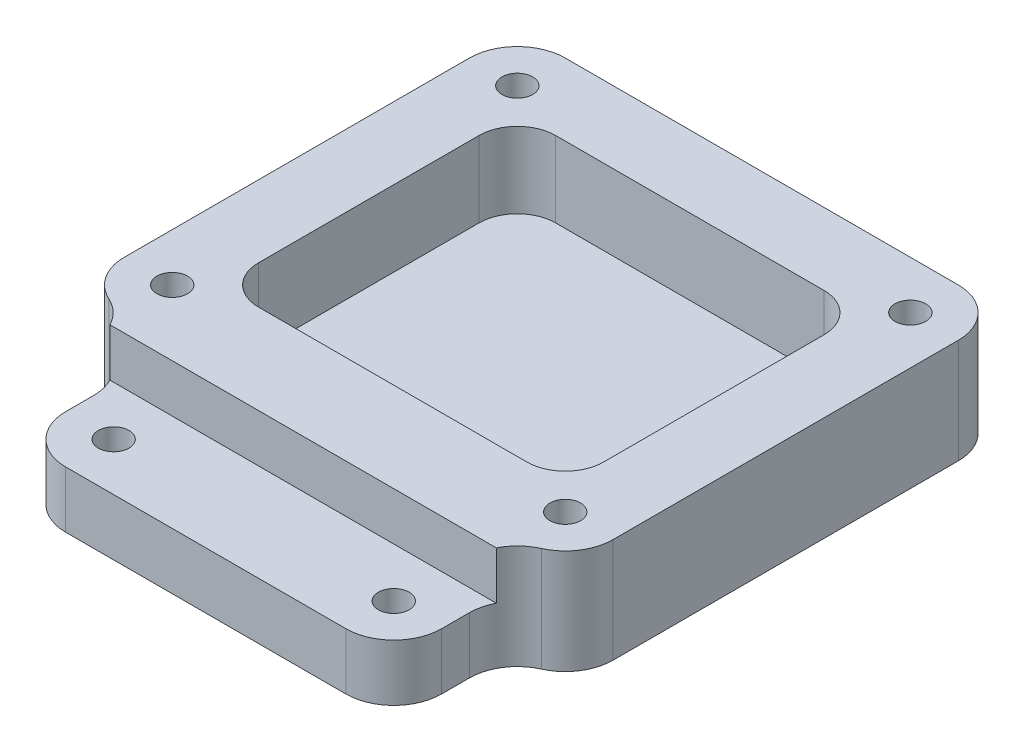
from build123d import *

# Parameters (mm, degrees)
SKETCH_1_W          = 51
SKETCH_1_H          = 46
SKETCH_1_R          = 1.6
SKETCH_1_W_2        = 39.22
SKETCH_1_H_2        = 12
EXTRUDE_1_DEPTH     = 10.9
SKETCH_2_W          = 39.22
SKETCH_2_H          = 10.3
CUT_EXTRUDE_1_DEPTH = 5
FILLET_1_R          = 5
SKETCH_3_W          = 36
SKETCH_3_H          = 31
CUT_EXTRUDE_2_DEPTH = 7.9
FILLET_3_R          = 4
FILLET_2_R          = 5


with BuildPart() as part:
    # ｽｹｯﾁ1 → ﾎﾞｽ - 押し出し1 (new body)
    # profile 1 of 2: a face of its own
    with BuildSketch(Plane(origin=(0, 0, 0), x_dir=(1, 0, 0), z_dir=(0, 1, 0))):
        Rectangle(SKETCH_1_W, SKETCH_1_H)
        with Locations(Location((-20.5, 18, 0), (0, 0, 270))):
            Circle(SKETCH_1_R, mode=Mode.SUBTRACT)
        with Locations(Location((20.5, 18, 0), (0, 0, 270))):
            Circle(SKETCH_1_R, mode=Mode.SUBTRACT)
        with Locations(Location((-20.5, -18, 0), (0, 0, 270))):
            Circle(SKETCH_1_R, mode=Mode.SUBTRACT)
        with Locations(Location((20.5, -18, 0), (0, 0, 270))):
            Circle(SKETCH_1_R, mode=Mode.SUBTRACT)
    # profile 2 of 2: a face of its own
    with BuildSketch(Plane(origin=(0, 0, 0), x_dir=(1, 0, 0), z_dir=(0, 1, 0))):
        with Locations((0, -29)):
            Rectangle(SKETCH_1_W_2, SKETCH_1_H_2)
        with Locations(Location((-14.61, -30, 0), (0, 0, 270))):
            Circle(SKETCH_1_R, mode=Mode.SUBTRACT)
        with Locations(Location((14.61, -30, 0), (0, 0, 270))):
            Circle(SKETCH_1_R, mode=Mode.SUBTRACT)
    extrude(amount=EXTRUDE_1_DEPTH)

    # ｽｹｯﾁ2 → ｶｯﾄ - 押し出し1 (cut)
    with BuildSketch(Plane(origin=(0, 10.9, 0), x_dir=(1, 0, 0), z_dir=(0, 1, 0))):
        with Locations((0, -30)):
            Rectangle(SKETCH_2_W, SKETCH_2_H)
    extrude(amount=-CUT_EXTRUDE_1_DEPTH, mode=Mode.SUBTRACT)

    # ﾌｨﾚｯﾄ1
    fillet_1_edges = [part.edges().sort_by_distance(p)[0] for p in [
        (-25.5, 5.45, 23),
        (-25.5, 5.45, -23),
        (25.5, 5.45, -23),
        (25.5, 5.45, 23),
        (19.61, 2.95, 35),
        (-19.61, 2.95, 35),
    ]]
    fillet(fillet_1_edges, radius=FILLET_1_R)

    # ｽｹｯﾁ3 → ｶｯﾄ - 押し出し2 (cut)
    with BuildSketch(Plane(origin=(0, 10.9, 0), x_dir=(1, 0, 0), z_dir=(0, 1, 0))):
        Rectangle(SKETCH_3_W, SKETCH_3_H)
    extrude(amount=-CUT_EXTRUDE_2_DEPTH, mode=Mode.SUBTRACT)

    # ﾌｨﾚｯﾄ3
    fillet_3_edges = [part.edges().sort_by_distance(p)[0] for p in [
        (18, 6.95, -15.5),
        (18, 6.95, 15.5),
        (-18, 6.95, 15.5),
        (-18, 6.95, -15.5),
    ]]
    fillet(fillet_3_edges, radius=FILLET_3_R)

    # ﾌｨﾚｯﾄ2
    # the kernel refuses this fillet: 5 mm, written as the material it adds along each edge
    with BuildSketch(Plane(origin=(-19.61, 0, 23), x_dir=(-0.9889327426199618, 0, -0.14836451925632577), z_dir=(0, 1, 0))) as fillet_2_piece_1_section:
        with BuildLine():
            CenterArc((4.333942914, 4.812619291), FILLET_2_R, 188.532159938, 65.732331269)
            Line((-0.610720799, 4.070796695), (-1.10518717, 3.996614435))
            Line((-1.10518717, 3.996614435), (-0.494466371, -0.07418226))
            Line((-0.494466371, -0.07418226), (0.07418226, -0.494466371))
            ThreePointArc((0.07418226, -0.494466371), (0.954332401, -0.362421949), (2.842359317, -0.481261929))
            Line((2.842359317, -0.481261929), (2.977957826, 0))
        make_face()
    fillet_2_piece_1 = extrude(amount=10.9, mode=Mode.PRIVATE)
    fillet_2_piece_1 = split(fillet_2_piece_1, bisect_by=Plane(origin=(-20.366453669, 5.9, 23.394752077), z_dir=(0, -1, 0)), keep=Keep.TOP, mode=Mode.PRIVATE)
    fillet_2_piece_1 = split(fillet_2_piece_1, bisect_by=Plane(origin=(-20.366453669, 2.95, 24.85), z_dir=(0, 0, -1)), keep=Keep.TOP, mode=Mode.PRIVATE)
    add(fillet_2_piece_1)
    with BuildSketch(Plane(origin=(-19.61, 0, 23), x_dir=(-0.9889327426199618, 0, -0.14836451925632577), z_dir=(0, 1, 0))) as fillet_2_piece_2_section:
        with BuildLine():
            CenterArc((4.333942914, 4.812619291), FILLET_2_R, 188.532159938, 65.732331269)
            Line((-0.610720799, 4.070796695), (-1.10518717, 3.996614435))
            Line((-1.10518717, 3.996614435), (-0.494466371, -0.07418226))
            Line((-0.494466371, -0.07418226), (0.07418226, -0.494466371))
            ThreePointArc((0.07418226, -0.494466371), (0.954332401, -0.362421949), (2.842359317, -0.481261929))
            Line((2.842359317, -0.481261929), (2.977957826, 0))
        make_face()
    fillet_2_piece_2 = extrude(amount=10.9, mode=Mode.PRIVATE)
    fillet_2_piece_2 = split(fillet_2_piece_2, bisect_by=Plane(origin=(-19.467497884, 5.9, 25.833436825), z_dir=(0, -1, 0)), keep=Keep.TOP, mode=Mode.PRIVATE)
    fillet_2_piece_2 = split(fillet_2_piece_2, bisect_by=Plane(origin=(-19.467497884, 2.95, 24.85), z_dir=(0, 0, 1)), keep=Keep.TOP, mode=Mode.PRIVATE)
    add(fillet_2_piece_2)
    with BuildSketch(Plane(origin=(-19.61, 0, 23), x_dir=(-0.9889327426199618, 0, -0.14836451925632577), z_dir=(0, 1, 0))) as fillet_2_piece_3_section:
        with BuildLine():
            CenterArc((4.333942914, 4.812619291), FILLET_2_R, 188.532159938, 65.732331269)
            Line((-0.610720799, 4.070796695), (-1.10518717, 3.996614435))
            Line((-1.10518717, 3.996614435), (-0.494466371, -0.07418226))
            Line((-0.494466371, -0.07418226), (0.07418226, -0.494466371))
            ThreePointArc((0.07418226, -0.494466371), (0.954332401, -0.362421949), (2.842359317, -0.481261929))
            Line((2.842359317, -0.481261929), (2.977957826, 0))
        make_face()
    fillet_2_piece_3 = extrude(amount=10.9, mode=Mode.PRIVATE)
    fillet_2_piece_3 = split(fillet_2_piece_3, bisect_by=Plane(origin=(-20.366453669, 5.9, 23.394752077), z_dir=(0, 1, 0)), keep=Keep.TOP, mode=Mode.PRIVATE)
    fillet_2_piece_3 = split(fillet_2_piece_3, bisect_by=Plane(origin=(-20.366453669, 8.4, 24.85), z_dir=(0, 0, -1)), keep=Keep.TOP, mode=Mode.PRIVATE)
    add(fillet_2_piece_3)
    with BuildSketch(Plane(origin=(19.61, 0, 23), x_dir=(0, 0, 1), z_dir=(0, 1, 0))) as fillet_2_piece_4_section:
        with BuildLine():
            CenterArc((4.116353438, 5), FILLET_2_R, 204.267668731, 65.732331269)
            Line((-0.441823281, 2.945), (-0.897640953, 2.7395))
            ThreePointArc((-0.897640953, 2.7395), (-0.5, 0.89), (-0.5, 0))
            Line((-0.5, 0), (0, -0.5))
            Line((0, -0.5), (4.116353438, -0.5))
            Line((4.116353438, -0.5), (4.116353438, 0))
        make_face()
    fillet_2_piece_4 = extrude(amount=10.9, mode=Mode.PRIVATE)
    fillet_2_piece_4 = split(fillet_2_piece_4, bisect_by=Plane(origin=(19.467497884, 2.95, 24.85), z_dir=(0, 0, 1)), keep=Keep.TOP, mode=Mode.PRIVATE)
    fillet_2_piece_4 = split(fillet_2_piece_4, bisect_by=Plane(origin=(19.467497884, 5.9, 25.833436825), z_dir=(0, -1, 0)), keep=Keep.TOP, mode=Mode.PRIVATE)
    add(fillet_2_piece_4)
    with BuildSketch(Plane(origin=(19.61, 0, 23), x_dir=(0, 0, 1), z_dir=(0, 1, 0))) as fillet_2_piece_5_section:
        with BuildLine():
            CenterArc((4.116353438, 5), FILLET_2_R, 204.267668731, 65.732331269)
            Line((-0.441823281, 2.945), (-0.897640953, 2.7395))
            ThreePointArc((-0.897640953, 2.7395), (-0.5, 0.89), (-0.5, 0))
            Line((-0.5, 0), (0, -0.5))
            Line((0, -0.5), (4.116353438, -0.5))
            Line((4.116353438, -0.5), (4.116353438, 0))
        make_face()
    fillet_2_piece_5 = extrude(amount=10.9, mode=Mode.PRIVATE)
    fillet_2_piece_5 = split(fillet_2_piece_5, bisect_by=Plane(origin=(20.366453669, 2.95, 24.85), z_dir=(0, 0, -1)), keep=Keep.TOP, mode=Mode.PRIVATE)
    fillet_2_piece_5 = split(fillet_2_piece_5, bisect_by=Plane(origin=(20.366453669, 5.9, 23.394752077), z_dir=(0, -1, 0)), keep=Keep.TOP, mode=Mode.PRIVATE)
    add(fillet_2_piece_5)
    with BuildSketch(Plane(origin=(19.61, 0, 23), x_dir=(0, 0, 1), z_dir=(0, 1, 0))) as fillet_2_piece_6_section:
        with BuildLine():
            CenterArc((4.116353438, 5), FILLET_2_R, 204.267668731, 65.732331269)
            Line((-0.441823281, 2.945), (-0.897640953, 2.7395))
            ThreePointArc((-0.897640953, 2.7395), (-0.5, 0.89), (-0.5, 0))
            Line((-0.5, 0), (0, -0.5))
            Line((0, -0.5), (4.116353438, -0.5))
            Line((4.116353438, -0.5), (4.116353438, 0))
        make_face()
    fillet_2_piece_6 = extrude(amount=10.9, mode=Mode.PRIVATE)
    fillet_2_piece_6 = split(fillet_2_piece_6, bisect_by=Plane(origin=(20.366453669, 8.4, 24.85), z_dir=(0, 0, -1)), keep=Keep.TOP, mode=Mode.PRIVATE)
    fillet_2_piece_6 = split(fillet_2_piece_6, bisect_by=Plane(origin=(20.366453669, 5.9, 23.394752077), z_dir=(0, 1, 0)), keep=Keep.TOP, mode=Mode.PRIVATE)
    add(fillet_2_piece_6)


solid = part.part
